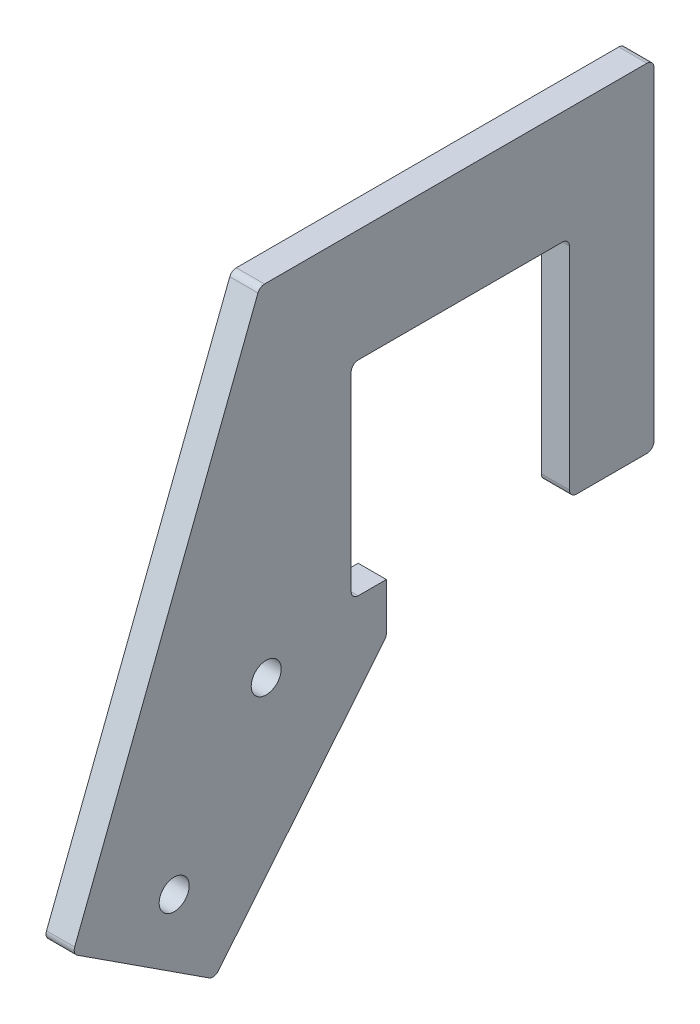
from build123d import *

# Parameters (mm, degrees)
BOSS_EXTRUDE1_DEPTH     = 6.35
F_1_4_CLEARANCE_HOLE1_D = 6.7564
FILLET1_R               = 1.5875
SKETCH8_W               = 7.9375
SKETCH8_H               = 46.0375
CUT_EXTRUDE1_DEPTH      = 1026.686391325
FILLET3_R               = 1.5875


with BuildPart() as part:
    # Sketch1 → Boss-Extrude1 (new body)
    with BuildSketch(Plane(origin=(0, 0, 0), x_dir=(0, 0, -1), z_dir=(1, 0, 0))):
        Polygon((164.408264107, 861.216812893), (203.2, 908.685), (203.2, 965.835), (244.475, 965.835), (244.475, 915.035), (263.525, 915.035), (263.525, 991.235), (174.625, 991.235), (132.454915468, 881.967560127), align=None)
    extrude(amount=BOSS_EXTRUDE1_DEPTH)

    # 1/4 Clearance Hole1 (through all)
    with Locations(Plane.ZY):
        with Locations((-176.099252766, 914.196651361), (-155.348505532, 882.243302723)):
            Hole(F_1_4_CLEARANCE_HOLE1_D / 2)

    # Fillet1
    fillet1_edges = [part.edges().sort_by_distance(p)[0] for p in [
        (3.175, 861.216812893, -164.408264107),
        (3.175, 881.967560127, -132.454915468),
        (3.175, 991.235, -174.625),
        (3.175, 991.235, -263.525),
        (3.175, 915.035, -263.525),
        (3.175, 915.035, -244.475),
        (3.175, 908.685, -203.2),
    ]]
    fillet(fillet1_edges, radius=FILLET1_R)

    # Sketch8 → Cut-Extrude1 (cut, through all)
    with BuildSketch(Plane.ZY):
        with Locations((-199.23125, 942.81625)):
            Rectangle(SKETCH8_W, SKETCH8_H)
    extrude(amount=-CUT_EXTRUDE1_DEPTH, mode=Mode.SUBTRACT)

    # Fillet3
    fillet3_edges = [part.edges().sort_by_distance(p)[0] for p in [
        (3.175, 919.7975, -195.2625),
        (3.175, 965.835, -195.2625),
        (3.175, 965.835, -244.475),
    ]]
    fillet(fillet3_edges, radius=FILLET3_R)


solid = part.part
